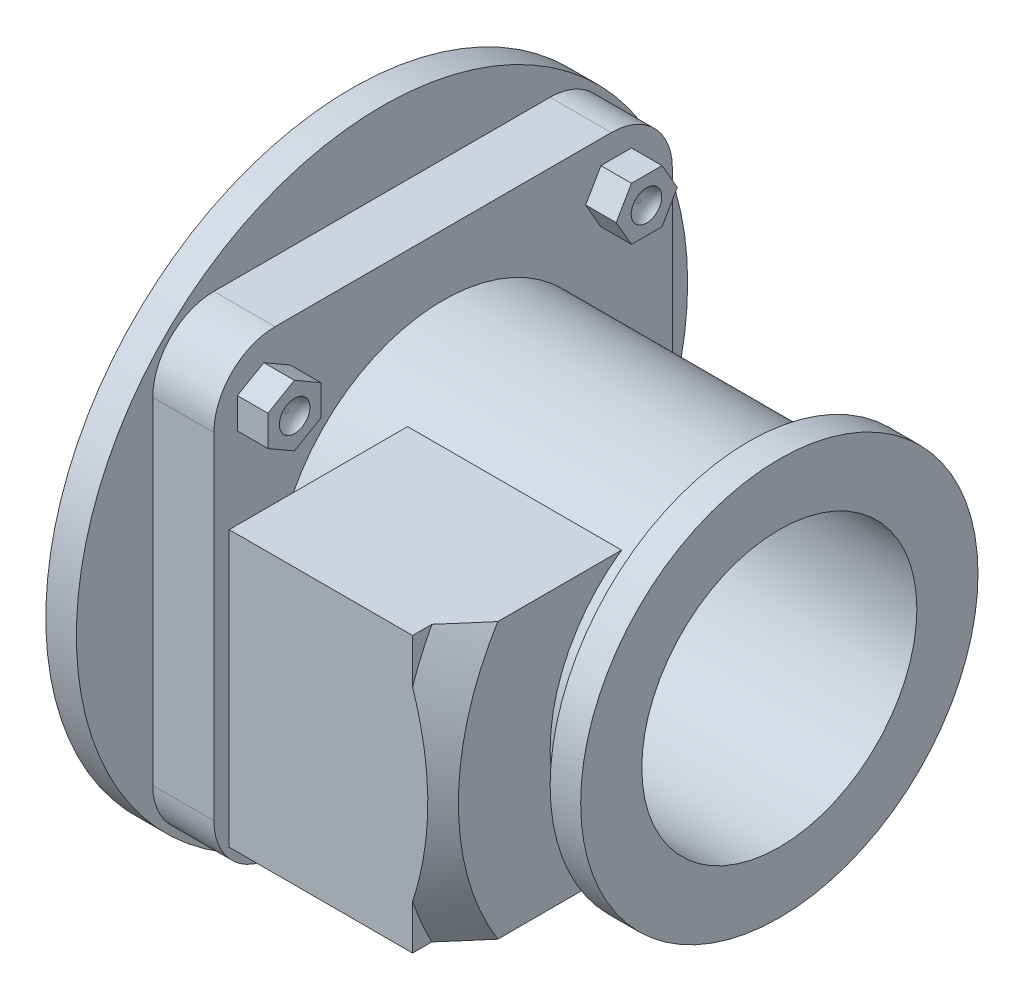
from build123d import *

# Parameters (mm, degrees)
SKETCH1_R                = 100
BOSS_EXTRUDE1_DEPTH      = 10
SKETCH2_W                = 150
SKETCH2_H                = 150
BOSS_EXTRUDE2_DEPTH      = 20
FILLET1_R                = 20
SKETCH3_R                = 55
BOSS_EXTRUDE3_DEPTH      = 100
SKETCH4_R                = 65
BOSS_EXTRUDE4_DEPTH      = 10
SKETCH5_W                = 70
SKETCH5_H                = 90
BOSS_EXTRUDE5_DEPTH      = 90
CUT_EXTRUDE1_DEPTH       = 10
CHAMFER1_SIZE            = 10
SKETCH7_R                = 45
CUT_EXTRUDE2_DEPTH       = 100
BOSS_EXTRUDE6_DEPTH      = 10
SKETCH9_R                = 5
CUT_EXTRUDE3_DEPTH       = 2.5
FILLET9_R                = 5
CIRPATTERN1_COUNT        = 4
FILLET9_OF_CIRPATTERN1_R = 5


with BuildPart() as part:
    # Sketch1 → Boss-Extrude1 (new body)
    with BuildSketch(Plane(origin=(0, 0, 0), x_dir=(0, 0, -1), z_dir=(1, 0, 0))):
        Circle(SKETCH1_R)
    extrude(amount=BOSS_EXTRUDE1_DEPTH)

    # Sketch2 → Boss-Extrude2 (add)
    with BuildSketch(Plane(origin=(10, 0, 0), x_dir=(0, 0, -1), z_dir=(1, 0, 0))):
        Rectangle(SKETCH2_W, SKETCH2_H)
    extrude(amount=BOSS_EXTRUDE2_DEPTH)

    # Fillet1
    # the kernel refuses this fillet: 20 mm, written as the material it takes off along each edge
    with BuildSketch(Plane(origin=(10, -75, -75), x_dir=(0, 1, 0), z_dir=(1, 0, 0)), Plane(origin=(10, 75, 75), x_dir=(0, -1, 0), z_dir=(1, 0, 0)), Plane(origin=(10, -75, 75), x_dir=(0, 0, -1), z_dir=(1, 0, 0))) as fillet1_piece_1:
        with BuildLine():
            CenterArc((FILLET1_R, FILLET1_R), FILLET1_R, 180, 90)
            Line((0, FILLET1_R), (0, 0))
            Line((0, 0), (FILLET1_R, 0))
        make_face()
    extrude(amount=70, mode=Mode.SUBTRACT)
    with BuildSketch(Plane(origin=(10, 75, -75), x_dir=(0, -1, 0), z_dir=(1, 0, 0))) as fillet1_piece_2:
        with BuildLine():
            CenterArc((FILLET1_R, -FILLET1_R), FILLET1_R, 90, 90)
            Line((0, -FILLET1_R), (0, 0))
            Line((0, 0), (FILLET1_R, 0))
        make_face()
    extrude(amount=70, mode=Mode.SUBTRACT)

    # Sketch3 → Boss-Extrude3 (add)
    with BuildSketch(Plane(origin=(30, 0, 0), x_dir=(0, 0, -1), z_dir=(1, 0, 0))):
        with Locations(Location((0, 0, 0), (0, 0, 180))):
            Circle(SKETCH3_R)
    extrude(amount=BOSS_EXTRUDE3_DEPTH)

    # Sketch4 → Boss-Extrude4 (add)
    with BuildSketch(Plane(origin=(130, 0, 0), x_dir=(0, 0, -1), z_dir=(1, 0, 0))):
        Circle(SKETCH4_R)
    extrude(amount=BOSS_EXTRUDE4_DEPTH)

    # Sketch5 → Boss-Extrude5 (add)
    with BuildSketch(Plane.XY):
        with Locations((85, 0)):
            Rectangle(SKETCH5_W, SKETCH5_H)
    extrude(amount=BOSS_EXTRUDE5_DEPTH)

    # Sketch6 → Cut-Extrude1 (cut)
    with BuildSketch(Plane(origin=(120, 0, 0), x_dir=(0, 0, -1), z_dir=(1, 0, 0))):
        with BuildLine():
            Line((-90, -45), (-72.111025509, -45))
            ThreePointArc((-72.111025509, -45), (-85, 0), (-72.111025509, 45))
            Line((-72.111025509, 45), (-90, 45))
            Line((-90, 45), (-90, -45))
        make_face()
    extrude(amount=-CUT_EXTRUDE1_DEPTH, mode=Mode.SUBTRACT)

    # Chamfer1
    # the kernel refuses this chamfer: 10 mm, written as the material it adds along each edge
    with BuildSketch(Plane(origin=(110, 0, 0), x_dir=(0, -0.7581812704151473, 0.6520438337962206), z_dir=(0, -0.6520438337962206, -0.7581812704151473))) as chamfer1_piece_1_section:
        Polygon((85, -CHAMFER1_SIZE), (85 + CHAMFER1_SIZE, 0), (85, 0), align=None)
    chamfer1_piece_1 = revolve(axis=Axis((110, 0, 0), (-1, 0, 0)), revolution_arc=98.608247973, mode=Mode.PRIVATE)
    chamfer1_piece_1 = split(chamfer1_piece_1, bisect_by=Plane(origin=(118.167671654, 45, 80.674313719), z_dir=(0, -1, 0)), keep=Keep.TOP, mode=Mode.PRIVATE)
    chamfer1_piece_1 = split(chamfer1_piece_1, bisect_by=Plane(origin=(120, -31.470599687, 80.674313719), z_dir=(-1, 0, 0)), keep=Keep.TOP, mode=Mode.PRIVATE)
    chamfer1_piece_1 = split(chamfer1_piece_1, bisect_by=Plane(origin=(118.167671654, -45, 80.674313719), z_dir=(0, 1, 0)), keep=Keep.TOP, mode=Mode.PRIVATE)
    chamfer1_piece_1 = split(chamfer1_piece_1, bisect_by=Plane(origin=(118.167671654, -31.470599687, 90), z_dir=(0, 0, -1)), keep=Keep.TOP, mode=Mode.PRIVATE)
    add(chamfer1_piece_1)

    # Sketch7 → Cut-Extrude2 (cut)
    with BuildSketch(Plane(origin=(140, 0, 0), x_dir=(0, 0, -1), z_dir=(1, 0, 0))):
        Circle(SKETCH7_R)
    extrude(amount=-CUT_EXTRUDE2_DEPTH, mode=Mode.SUBTRACT)

    # Sketch8 → Boss-Extrude6 (add)
    with BuildSketch(Plane(origin=(30, 0, 0), x_dir=(0, 0, -1), z_dir=(1, 0, 0))):
        Polygon((67.320508076, -61.627449546), (67.320508076, -51.627449546), (58.660254038, -46.627449546), (50, -51.627449546), (50, -61.627449546), (58.660254038, -66.627449546), align=None)
    boss_extrude6 = extrude(amount=BOSS_EXTRUDE6_DEPTH)

    # Sketch9 → Cut-Extrude3 (cut)
    with BuildSketch(Plane(origin=(40, 0, 0), x_dir=(0, 0, -1), z_dir=(1, 0, 0))):
        with Locations((58.588222401, -56.525256823)):
            Circle(SKETCH9_R)
    cut_extrude3 = extrude(amount=-CUT_EXTRUDE3_DEPTH, mode=Mode.SUBTRACT)

    # Fillet9
    # the kernel refuses this fillet: 5 mm, written as the material it adds along each edge
    with BuildSketch(Plane(origin=(37.5, -56.525256823, -58.588222401), x_dir=(0, 0, -1), z_dir=(0, -1, 0))) as fillet9_piece_1:
        with BuildLine():
            CenterArc((0.669872981, 5), FILLET9_R, 270, 60)
            Line((0.669872981, 0), (0.669872981, -0.1))
            Line((0.669872981, -0.1), (5, -0.1))
            Line((5, -0.1), (5.1, 0))
            ThreePointArc((5.1, 0), (5.1, 1.25), (5.08660254, 2.45))
            Line((5.08660254, 2.45), (5, 2.5))
        make_face()
    revolve(axis=Axis((37.5, -56.525256823, -58.588222401), (1, 0, 0)))

    # CirPattern1: Boss-Extrude6, Cut-Extrude3 ×4 about axis
    cirpattern1_axis = Axis((0, 0, 0), (1, 0, 0))
    add([boss_extrude6.rotate(cirpattern1_axis, i * 360 / CIRPATTERN1_COUNT) for i in range(1, CIRPATTERN1_COUNT)])
    add([cut_extrude3.rotate(cirpattern1_axis, i * 360 / CIRPATTERN1_COUNT) for i in range(1, CIRPATTERN1_COUNT)], mode=Mode.SUBTRACT)

    # Fillet9 of CirPattern1
    # the kernel refuses this fillet: 5 mm, written as the material it adds along each edge
    with BuildSketch(Plane(origin=(37.5, 58.588222401, -56.525256823), x_dir=(0, 1, 0), z_dir=(0, 0, -1))) as fillet9_of_cirpattern1_piece_1:
        with BuildLine():
            CenterArc((0.669872981, 5), FILLET9_OF_CIRPATTERN1_R, 270, 60)
            Line((0.669872981, 0), (0.669872981, -0.1))
            Line((0.669872981, -0.1), (5, -0.1))
            Line((5, -0.1), (5.1, 0))
            ThreePointArc((5.1, 0), (5.1, 1.25), (5.08660254, 2.45))
            Line((5.08660254, 2.45), (5, 2.5))
        make_face()
    revolve(axis=Axis((37.5, 58.588222401, -56.525256823), (1, 0, 0)))
    with BuildSketch(Plane(origin=(37.5, 56.525256823, 58.588222401), x_dir=(0, 0, 1), z_dir=(0, 1, 0))) as fillet9_of_cirpattern1_piece_2:
        with BuildLine():
            CenterArc((0.669872981, 5), FILLET9_OF_CIRPATTERN1_R, 270, 60)
            Line((0.669872981, 0), (0.669872981, -0.1))
            Line((0.669872981, -0.1), (5, -0.1))
            Line((5, -0.1), (5.1, 0))
            ThreePointArc((5.1, 0), (5.1, 1.25), (5.08660254, 2.45))
            Line((5.08660254, 2.45), (5, 2.5))
        make_face()
    revolve(axis=Axis((37.5, 56.525256823, 58.588222401), (1, 0, 0)))
    with BuildSketch(Plane(origin=(37.5, -58.588222401, 56.525256823), x_dir=(0, -1, 0), z_dir=(0, 0, 1))) as fillet9_of_cirpattern1_piece_3:
        with BuildLine():
            CenterArc((0.669872981, 5), FILLET9_OF_CIRPATTERN1_R, 270, 60)
            Line((0.669872981, 0), (0.669872981, -0.1))
            Line((0.669872981, -0.1), (5, -0.1))
            Line((5, -0.1), (5.1, 0))
            ThreePointArc((5.1, 0), (5.1, 1.25), (5.08660254, 2.45))
            Line((5.08660254, 2.45), (5, 2.5))
        make_face()
    revolve(axis=Axis((37.5, -58.588222401, 56.525256823), (1, 0, 0)))


solid = part.part
